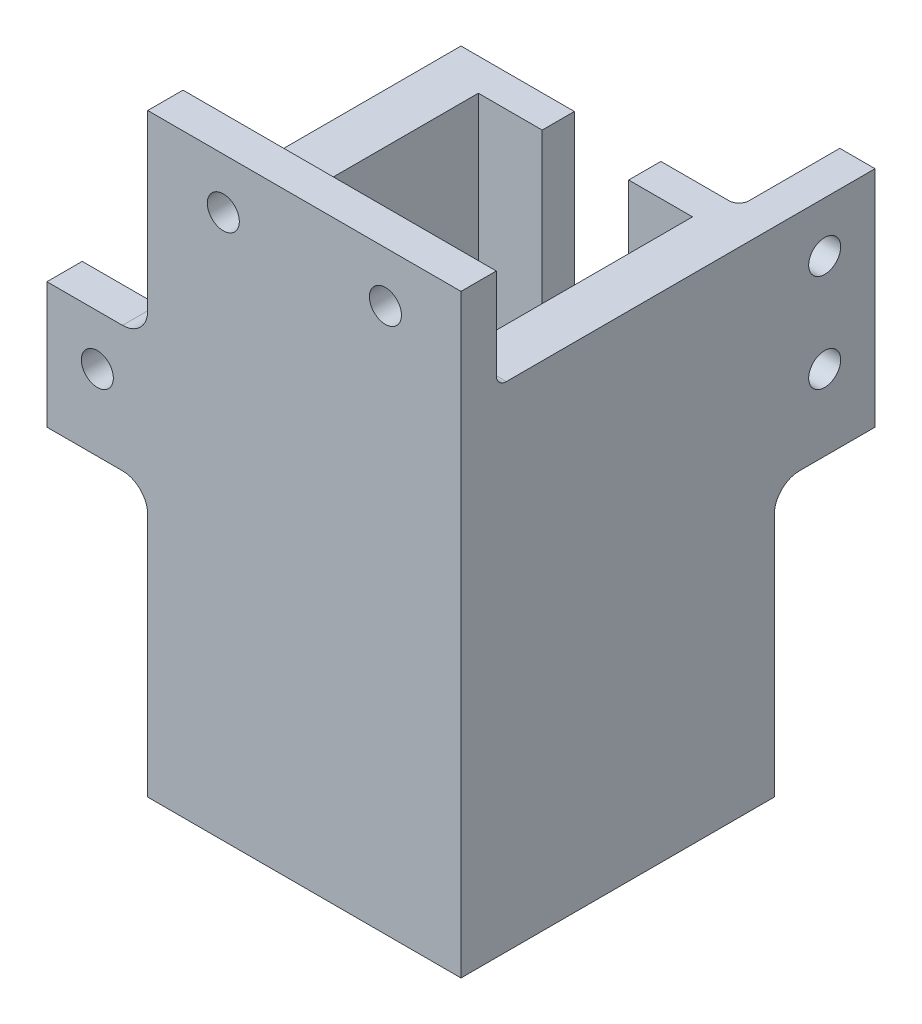
from build123d import *

# Parameters (mm, degrees)
BOSS_EXTRUDE1_DEPTH = 48
SKETCH2_W           = 62.166
SKETCH2_H           = 62.166
BOSS_EXTRUDE2_DEPTH = 50
SKETCH5_W           = 7
SKETCH5_H           = 44.425
BOSS_EXTRUDE3_DEPTH = 20
SKETCH8_W           = 62.166
SKETCH8_H           = 7
BOSS_EXTRUDE4_DEPTH = 20
SKETCH10_W          = 7
SKETCH10_H          = 25
BOSS_EXTRUDE5_DEPTH = 20
SKETCH7_R           = 3.175
CUT_EXTRUDE1_DEPTH  = 112.997755
SKETCH9_R           = 3.175
CUT_EXTRUDE2_DEPTH  = 114.505068
SKETCH11_R          = 3.175
CUT_EXTRUDE3_DEPTH  = 114.505068
FILLET1_R           = 2
FILLET2_START       = 25.526
FILLET2_DEPTH       = 9
FILLET2_START_2     = 22.083
FILLET2_2_DEPTH     = 9
FILLET2_START_3     = -2
FILLET2_3_DEPTH     = 37


with BuildPart() as part:
    # Sketch1 → Boss-Extrude1 (new body)
    with BuildSketch(Plane(origin=(0, 0, 0), x_dir=(1, 0, 0), z_dir=(0, 1, 0))):
        Polygon((8.583, 21.25), (8.583, 27.64), (31.083, 27.64), (31.083, -34.526), (-31.083, -34.526), (-31.083, 27.64), (-8.583, 27.64), (-8.583, 21.25), (-21.25, 21.25), (-21.25, -21.25), (21.25, -21.25), (21.25, 21.25), align=None)
    extrude(amount=BOSS_EXTRUDE1_DEPTH)

    # Sketch2 → Boss-Extrude2 (add)
    with BuildSketch(Plane(origin=(0, 0, 0), x_dir=(1, 0, 0), z_dir=(0, 1, 0))):
        with Locations((0, -3.443)):
            Rectangle(SKETCH2_W, SKETCH2_H)
    extrude(amount=-BOSS_EXTRUDE2_DEPTH)

    # Sketch5 → Boss-Extrude3 (add)
    with BuildSketch(Plane(origin=(0, 0, -27.64), x_dir=(-1, 0, 0), z_dir=(0, 0, -1))):
        with Locations((-27.583, 25.7875)):
            Rectangle(SKETCH5_W, SKETCH5_H)
    extrude(amount=BOSS_EXTRUDE3_DEPTH)

    # Sketch8 → Boss-Extrude4 (add)
    with BuildSketch(Plane(origin=(0, 48, 0), x_dir=(1, 0, 0), z_dir=(0, 1, 0))):
        with Locations((0, -31.026)):
            Rectangle(SKETCH8_W, SKETCH8_H)
    extrude(amount=BOSS_EXTRUDE4_DEPTH)

    # Sketch10 → Boss-Extrude5 (add)
    with BuildSketch(Plane.ZY.offset(31.083)):
        with Locations((31.026, 16.075)):
            Rectangle(SKETCH10_W, SKETCH10_H)
    extrude(amount=BOSS_EXTRUDE5_DEPTH)

    # Sketch7 → Cut-Extrude1 (cut, through all)
    with BuildSketch(Plane.ZY.offset(-24.083)):
        with Locations(Location((-37.64, 38, 0), (0, 0, 270))):
            Circle(SKETCH7_R)
        with Locations(Location((-37.64, 18.575, 0), (0, 0, 270))):
            Circle(SKETCH7_R)
    extrude(amount=-CUT_EXTRUDE1_DEPTH, mode=Mode.SUBTRACT)

    # Sketch9 → Cut-Extrude2 (cut, through all)
    with BuildSketch(Plane(origin=(0, 0, 27.526), x_dir=(-1, 0, 0), z_dir=(0, 0, -1))):
        with Locations((-16.083, 58)):
            Circle(SKETCH9_R)
        with Locations((16.083, 58)):
            Circle(SKETCH9_R)
    extrude(amount=-CUT_EXTRUDE2_DEPTH, mode=Mode.SUBTRACT)

    # Sketch11 → Cut-Extrude3 (cut, through all)
    with BuildSketch(Plane(origin=(0, 0, 27.526), x_dir=(-1, 0, 0), z_dir=(0, 0, -1))):
        with Locations((41.083, 18.575)):
            Circle(SKETCH11_R)
    extrude(amount=-CUT_EXTRUDE3_DEPTH, mode=Mode.SUBTRACT)

    # Fillet1
    # the kernel refuses this fillet: 2 mm, written as the material it adds along each edge
    with BuildSketch(Plane(origin=(31.083, 48, 27.526), x_dir=(0, 0, -1), z_dir=(-1, 0, 0))) as fillet1_piece_1:
        with BuildLine():
            CenterArc((FILLET1_R, -FILLET1_R), FILLET1_R, 90, 90)
            Line((0, -FILLET1_R), (0, 0))
            Line((0, 0), (FILLET1_R, 0))
        make_face()
    extrude(amount=62.166)
    with BuildSketch(Plane(origin=(-31.083, 28.575, 27.526), x_dir=(0, 0, -1), z_dir=(0, -1, 0))) as fillet1_piece_2:
        with BuildLine():
            CenterArc((FILLET1_R, -FILLET1_R), FILLET1_R, 90, 90)
            Line((0, -FILLET1_R), (0, 0))
            Line((0, 0), (FILLET1_R, 0))
        make_face()
    extrude(amount=25)
    with BuildSketch(Plane(origin=(24.083, 48, -27.64), x_dir=(-1, 0, 0), z_dir=(0, -1, 0))) as fillet1_piece_3:
        with BuildLine():
            CenterArc((FILLET1_R, FILLET1_R), FILLET1_R, 180, 90)
            Line((0, FILLET1_R), (0, 0))
            Line((0, 0), (FILLET1_R, 0))
        make_face()
    extrude(amount=44.425)

    # Fillet2: read off the stored shape, not the designer's step
    # Fillet2 outline → Fillet2 (add)
    with BuildSketch(Plane.XY.offset(FILLET2_START)):
        with BuildLine():
            Line((-31.083, -1.425), (-31.083, 3.575))
            Line((-31.083, 3.575), (-36.083, 3.575))
            ThreePointArc((-36.083, 3.575), (-32.547466, 2.110534), (-31.083, -1.425))
        make_face()
        with BuildLine():
            ThreePointArc((-31.083, 33.575), (-32.547466, 30.039466), (-36.083, 28.575))
            Line((-36.083, 28.575), (-31.083, 28.575))
            Line((-31.083, 28.575), (-31.083, 33.575))
        make_face()
    extrude(amount=FILLET2_DEPTH)

    # Fillet2 2 outline → Fillet2 2 (add)
    with BuildSketch(Plane.YZ.offset(FILLET2_START_2)):
        with BuildLine():
            ThreePointArc((-1.425, -27.64), (2.110534, -29.104466), (3.575, -32.64))
            Line((3.575, -32.64), (3.575, -27.64))
            Line((3.575, -27.64), (-1.425, -27.64))
        make_face()
    extrude(amount=FILLET2_2_DEPTH)

    # Fillet2 3 outline → Fillet2 3 (cut)
    with BuildSketch(Plane(origin=(0, 0, 0), x_dir=(1, 0, 0), z_dir=(0, 1, 0)).offset(FILLET2_START_3)):
        with BuildLine():
            ThreePointArc((-33.083, -27.526), (-31.668786, -26.940214), (-31.083, -25.526))
            Line((-31.083, -25.526), (-36.083, -25.526))
            Line((-36.083, -25.526), (-36.083, -27.526))
            Line((-36.083, -27.526), (-33.083, -27.526))
        make_face()
        with BuildLine():
            Line((24.083, 32.64), (22.083, 32.64))
            Line((22.083, 32.64), (22.083, 27.64))
            ThreePointArc((22.083, 27.64), (23.497214, 28.225786), (24.083, 29.64))
            Line((24.083, 29.64), (24.083, 32.64))
        make_face()
    extrude(amount=FILLET2_3_DEPTH, mode=Mode.SUBTRACT)


solid = part.part
